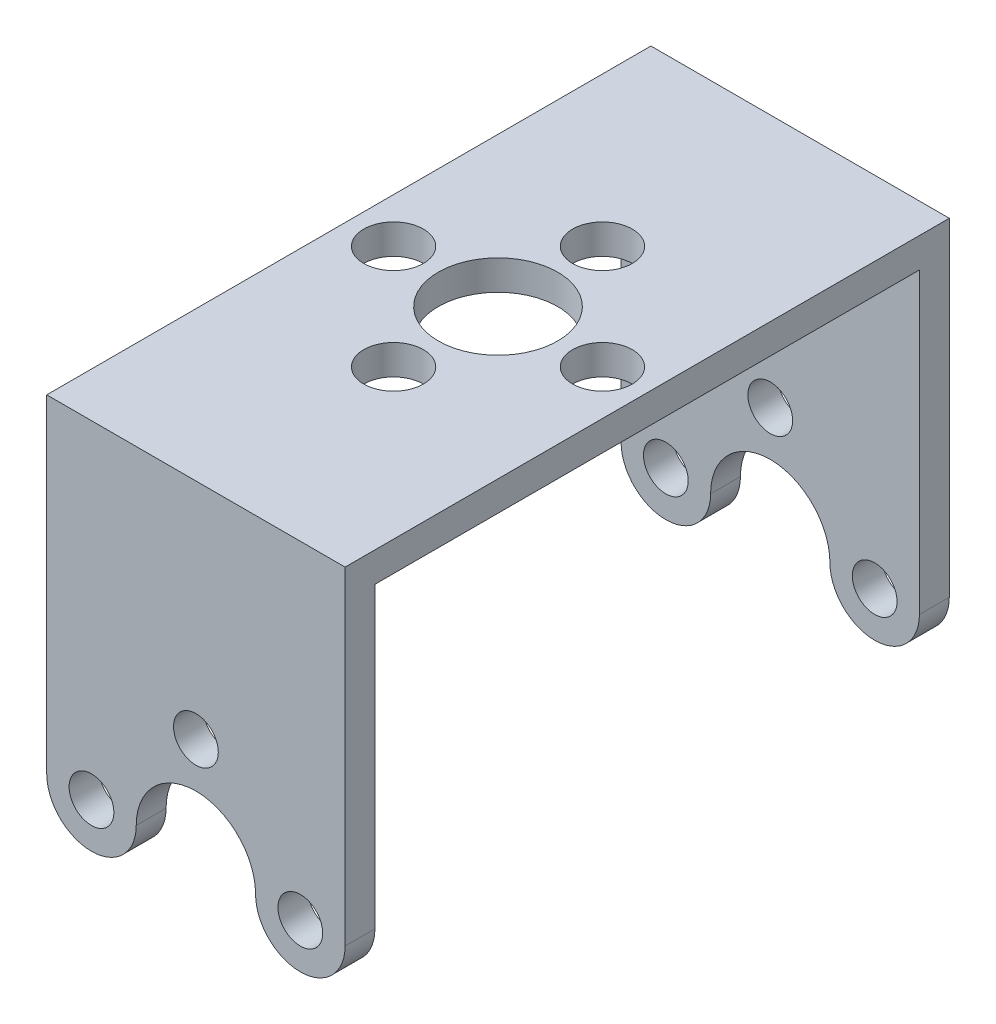
from build123d import *

# Parameters (mm, degrees)
CROQUIS1_R              = 1.5
SALIENTE_EXTRUIR3_DEPTH = 2
CROQUIS7_W              = 20
CROQUIS7_H              = 20.25
SALIENTE_EXTRUIR4_DEPTH = 2
CROQUIS15_R             = 2
CROQUIS15_R_2           = 4
CORTAR_EXTRUIR1_DEPTH   = 10


with BuildPart() as part:
    # Croquis1 → Saliente-Extruir3 (new body)
    with BuildSketch(Plane.XY.offset(325.976420163)):
        with BuildLine():
            Line((-20.593054102, 17.650860191), (-20.593054102, -2.349139809))
            ThreePointArc((-20.593054102, -2.349139809), (-17.593054102, -5.349139809), (-14.593054102, -2.349139809))
            ThreePointArc((-14.593054102, -2.349139809), (-10.593054102, 1.650860191), (-6.593054102, -2.349139809))
            ThreePointArc((-6.593054102, -2.349139809), (-3.593054102, -5.349139809), (-0.593054102, -2.349139809))
            Line((-0.593054102, -2.349139809), (-0.593054102, 17.650860191))
            ThreePointArc((-0.593054102, 17.650860191), (-1.17884054, 19.065073753), (-2.593054102, 19.650860191))
            Line((-2.593054102, 19.650860191), (-18.593054102, 19.650860191))
            ThreePointArc((-18.593054102, 19.650860191), (-20.007267664, 19.065073753), (-20.593054102, 17.650860191))
        make_face()
        with Locations((-17.593054102, -2.349139809)):
            Circle(CROQUIS1_R, mode=Mode.SUBTRACT)
        with Locations((-10.593054102, 4.650860191)):
            Circle(CROQUIS1_R, mode=Mode.SUBTRACT)
        with Locations((-3.593054102, -2.349139809)):
            Circle(CROQUIS1_R, mode=Mode.SUBTRACT)
    extrude(amount=SALIENTE_EXTRUIR3_DEPTH)


with BuildPart() as part_1:
    # Sólido-Mover/Copiar1: read off the stored shape, not the designer's step
    # Sólido-Mover/Copiar1: moved
    add(part.part.moved(Location((0, 0, -325.9764202))))

    # Croquis7 → Saliente-Extruir4 (add)
    with BuildSketch(Plane(origin=(0, 19.650860191, 0), x_dir=(-1, 0, 0), z_dir=(0, 1, 0))):
        with Locations((10.593054102, 10.125)):
            Rectangle(CROQUIS7_W, CROQUIS7_H)
    extrude(amount=-SALIENTE_EXTRUIR4_DEPTH)

    # Simetría5: part across plane


with BuildPart() as part_2:
    add(part_1.part)
    add(part_1.part.mirror(Plane(origin=(-0.593054102, 17.650860191, 20.25), x_dir=(1, 0, 0), z_dir=(0, 0, 1))))

    # Croquis15 → Cortar-Extruir1 (cut)
    with BuildSketch(Plane(origin=(0, 19.650860191, 0), x_dir=(-1, 0, 0), z_dir=(0, 1, 0))):
        with Locations(Location((10.593054102, 27.25, 0), (0, 0, 90))):
            Circle(CROQUIS15_R)
        with Locations(Location((17.593054102, 20.25, 0), (0, 0, 90))):
            Circle(CROQUIS15_R)
        with Locations(Location((10.593054102, 13.25, 0), (0, 0, 90))):
            Circle(CROQUIS15_R)
        with Locations(Location((3.593054102, 20.25, 0), (0, 0, 90))):
            Circle(CROQUIS15_R)
        with Locations(Location((10.593054102, 20.25, 0), (0, 0, 90))):
            Circle(CROQUIS15_R_2)
    extrude(amount=-CORTAR_EXTRUIR1_DEPTH, mode=Mode.SUBTRACT)


solid = part_2.part
